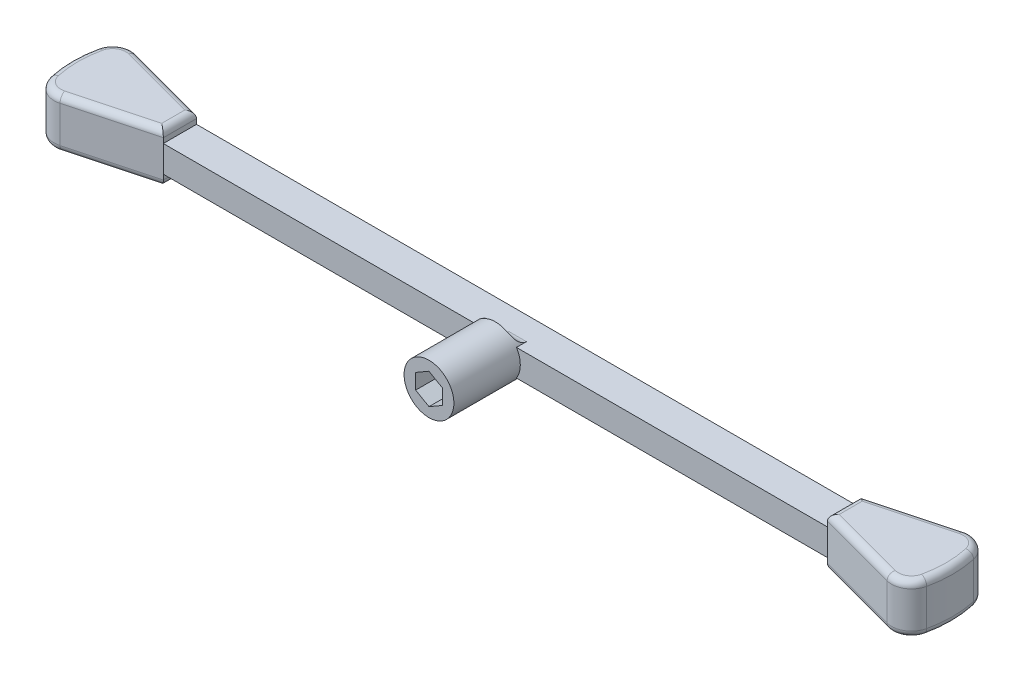
from build123d import *

# Parameters (mm, degrees)
SKETCH_1_R      = 7.5
EXTRUDE_1_DEPTH = 20
SKETCH_2_W      = 200
SKETCH_2_H      = 8
EXTRUDE_2_DEPTH = 10
EXTRUDE_3_DEPTH = 7.5
FILLET_2_R      = 6
FILLET_3_R      = 2
FILLET_4_R      = 3


with BuildPart() as part:
    # 草图1 → 凸台-拉伸1 (new body)
    with BuildSketch(Plane.XY):
        Circle(SKETCH_1_R)
        Polygon((0, -4.618802154), (4, -2.309401077), (4, 2.309401077), (0, 4.618802154), (-4, 2.309401077), (-4, -2.309401077), align=None, mode=Mode.SUBTRACT)
    extrude(amount=EXTRUDE_1_DEPTH)

    # 草图2 → 凸台-拉伸2 (add)
    with BuildSketch(Plane(origin=(0, 0, 0), x_dir=(-1, 0, 0), z_dir=(0, 0, -1))):
        Rectangle(SKETCH_2_W, SKETCH_2_H)
    extrude(amount=EXTRUDE_2_DEPTH)

    # 草图3 → 凸台-拉伸3 (add, symmetric)
    with BuildSketch(Plane(origin=(0, 0, 0), x_dir=(1, 0, 0), z_dir=(0, 1, 0))):
        with BuildLine():
            Line((-100, 10), (-130, 18.038475773))
            ThreePointArc((-130, 18.038475773), (-132.710882753, 5), (-130, -8.038475773))
            Line((-130, -8.038475773), (-100, 0))
            Line((-100, 0), (-100, 10))
        make_face()
        with BuildLine():
            Line((100, 10), (100, 0))
            Line((100, 0), (130, -8.038475773))
            ThreePointArc((130, -8.038475773), (132.710882753, 5), (130, 18.038475773))
            Line((130, 18.038475773), (100, 10))
        make_face()
    extrude(amount=EXTRUDE_3_DEPTH, both=True)

    # 圆角2
    fillet_2_edges = [part.edges().sort_by_distance(p)[0] for p in [
        (-130, 0, -18.038475773),
        (-130, 0, 8.038475773),
        (130, 0, 8.038475773),
        (130, 0, -18.038475773),
    ]]
    fillet(fillet_2_edges, radius=FILLET_2_R)

    # 圆角3
    fillet_3_edges = [part.edges().sort_by_distance(p)[0] for p in [
        (-100, -7.5, -5),
        (-112.262976322, -7.5, -13.285854602),
        (-100, 7.5, -5),
        (-112.262976322, 7.5, -13.285854602),
        (100, -7.5, -5),
        (112.262976322, -7.5, 3.285854602),
        (100, 7.5, -5),
        (112.262976322, 7.5, 3.285854602),
        (-132.710882753, -7.5, -5),
        (-132.710882753, 7.5, -5),
        (-112.262976322, -7.5, 3.285854602),
        (-129.192011847, -7.5, 5.905318763),
        (-129.192011847, -7.5, -15.905318763),
        (-112.262976322, 7.5, 3.285854602),
        (-129.192011847, 7.5, 5.905318763),
        (-129.192011847, 7.5, -15.905318763),
        (112.262976322, -7.5, -13.285854602),
        (112.262976322, 7.5, -13.285854602),
        (132.710882753, -7.5, -5),
        (129.192011847, -7.5, 5.905318763),
        (129.192011847, -7.5, -15.905318763),
        (132.710882753, 7.5, -5),
        (129.192011847, 7.5, 5.905318763),
        (129.192011847, 7.5, -15.905318763),
    ]]
    fillet(fillet_3_edges, radius=FILLET_3_R)

    # 圆角4
    # the kernel refuses this fillet: 3 mm, written as the material it adds along each edge
    with BuildSketch(Plane(origin=(-6.42820323, -4, 0), x_dir=(0, 0, -1), z_dir=(1, 0, 0))) as fillet_4_piece_1_section:
        with BuildLine():
            CenterArc((FILLET_4_R, -FILLET_4_R), FILLET_4_R, 90, 90)
            Line((0, -FILLET_4_R), (0, 0))
            Line((0, 0), (FILLET_4_R, 0))
        make_face()
    fillet_4_piece_1 = extrude(amount=20.272492001, mode=Mode.PRIVATE)
    fillet_4_piece_1 = fillet_4_piece_1 & Plane(origin=(0, 0, -0.715829883), x_dir=(1, 0, 0), z_dir=(0, 0, -1)) * Cylinder(7.5, 53, mode=Mode.PRIVATE)
    fillet_4_piece_1 = split(fillet_4_piece_1, bisect_by=Plane(origin=(-2.485789841, -3.18363072, -0.715829883), z_dir=(-0.5000000000000003, -0.8660254037844387, 0)), keep=Keep.TOP, mode=Mode.PRIVATE)
    add(fillet_4_piece_1)
    with BuildSketch(Plane(origin=(-6.42820323, -4, 0), x_dir=(0, 0, -1), z_dir=(1, 0, 0))) as fillet_4_piece_2_section:
        with BuildLine():
            CenterArc((FILLET_4_R, -FILLET_4_R), FILLET_4_R, 90, 90)
            Line((0, -FILLET_4_R), (0, 0))
            Line((0, 0), (FILLET_4_R, 0))
        make_face()
    fillet_4_piece_2 = extrude(amount=20.272492001, mode=Mode.PRIVATE)
    fillet_4_piece_2 = fillet_4_piece_2 & Plane(origin=(0, 0, -0.715830721), x_dir=(1, 0, 0), z_dir=(0, 0, -1)) * Cylinder(7.5, 53, mode=Mode.PRIVATE)
    fillet_4_piece_2 = split(fillet_4_piece_2, bisect_by=Plane(origin=(2.485790597, -3.183630283, -0.715830721), z_dir=(0.4999999999999999, -0.8660254037844388, 0)), keep=Keep.TOP, mode=Mode.PRIVATE)
    add(fillet_4_piece_2)
    with BuildSketch(Plane(origin=(-13.84428877, -4, 0), x_dir=(0, 0, -1), z_dir=(1, 0, 0))) as fillet_4_piece_3_section:
        with BuildLine():
            CenterArc((FILLET_4_R, -FILLET_4_R), FILLET_4_R, 90, 90)
            Line((0, -FILLET_4_R), (0, 0))
            Line((0, 0), (FILLET_4_R, 0))
        make_face()
    fillet_4_piece_3 = extrude(amount=20.272492001, mode=Mode.PRIVATE)
    fillet_4_piece_3 = fillet_4_piece_3 & Plane(origin=(0, 0, -0.715829883), x_dir=(1, 0, 0), z_dir=(0, 0, -1)) * Cylinder(7.5, 53, mode=Mode.PRIVATE)
    fillet_4_piece_3 = split(fillet_4_piece_3, bisect_by=Plane(origin=(-2.485789841, -3.18363072, -0.715829883), z_dir=(-0.5000000000000003, -0.8660254037844387, 0)), keep=Keep.TOP, mode=Mode.PRIVATE)
    add(fillet_4_piece_3)
    with BuildSketch(Plane(origin=(-13.84428877, -4, 0), x_dir=(0, 0, -1), z_dir=(1, 0, 0))) as fillet_4_piece_4_section:
        with BuildLine():
            CenterArc((FILLET_4_R, -FILLET_4_R), FILLET_4_R, 90, 90)
            Line((0, -FILLET_4_R), (0, 0))
            Line((0, 0), (FILLET_4_R, 0))
        make_face()
    fillet_4_piece_4 = extrude(amount=20.272492001, mode=Mode.PRIVATE)
    fillet_4_piece_4 = fillet_4_piece_4 & Plane(origin=(0, 0, -0.715830721), x_dir=(1, 0, 0), z_dir=(0, 0, -1)) * Cylinder(7.5, 53, mode=Mode.PRIVATE)
    fillet_4_piece_4 = split(fillet_4_piece_4, bisect_by=Plane(origin=(2.485790597, -3.183630283, -0.715830721), z_dir=(0.4999999999999999, -0.8660254037844388, 0)), keep=Keep.TOP, mode=Mode.PRIVATE)
    add(fillet_4_piece_4)
    with BuildSketch(Plane(origin=(6.42820323, 4, 0), x_dir=(0, 0, -1), z_dir=(-1, 0, 0))) as fillet_4_piece_5_section:
        with BuildLine():
            CenterArc((FILLET_4_R, -FILLET_4_R), FILLET_4_R, 90, 90)
            Line((0, -FILLET_4_R), (0, 0))
            Line((0, 0), (FILLET_4_R, 0))
        make_face()
    fillet_4_piece_5 = extrude(amount=20.272492001, mode=Mode.PRIVATE)
    fillet_4_piece_5 = fillet_4_piece_5 & Plane(origin=(0, 0, -0.715829883), x_dir=(1, 0, 0), z_dir=(0, 0, -1)) * Cylinder(7.5, 53, mode=Mode.PRIVATE)
    fillet_4_piece_5 = split(fillet_4_piece_5, bisect_by=Plane(origin=(2.485789841, 3.18363072, -0.715829883), z_dir=(0.5, 0.8660254037844387, 0)), keep=Keep.TOP, mode=Mode.PRIVATE)
    add(fillet_4_piece_5)
    with BuildSketch(Plane(origin=(6.42820323, 4, 0), x_dir=(0, 0, -1), z_dir=(-1, 0, 0))) as fillet_4_piece_6_section:
        with BuildLine():
            CenterArc((FILLET_4_R, -FILLET_4_R), FILLET_4_R, 90, 90)
            Line((0, -FILLET_4_R), (0, 0))
            Line((0, 0), (FILLET_4_R, 0))
        make_face()
    fillet_4_piece_6 = extrude(amount=20.272492001, mode=Mode.PRIVATE)
    fillet_4_piece_6 = fillet_4_piece_6 & Plane(origin=(0, 0, -0.715830721), x_dir=(1, 0, 0), z_dir=(0, 0, -1)) * Cylinder(7.5, 53, mode=Mode.PRIVATE)
    fillet_4_piece_6 = split(fillet_4_piece_6, bisect_by=Plane(origin=(-2.485790597, 3.183630283, -0.715830721), z_dir=(-0.5000000000000001, 0.8660254037844387, 0)), keep=Keep.TOP, mode=Mode.PRIVATE)
    add(fillet_4_piece_6)
    with BuildSketch(Plane(origin=(13.84428877, 4, 0), x_dir=(0, 0, -1), z_dir=(-1, 0, 0))) as fillet_4_piece_7_section:
        with BuildLine():
            CenterArc((FILLET_4_R, -FILLET_4_R), FILLET_4_R, 90, 90)
            Line((0, -FILLET_4_R), (0, 0))
            Line((0, 0), (FILLET_4_R, 0))
        make_face()
    fillet_4_piece_7 = extrude(amount=20.272492001, mode=Mode.PRIVATE)
    fillet_4_piece_7 = fillet_4_piece_7 & Plane(origin=(0, 0, -0.715829883), x_dir=(1, 0, 0), z_dir=(0, 0, -1)) * Cylinder(7.5, 53, mode=Mode.PRIVATE)
    fillet_4_piece_7 = split(fillet_4_piece_7, bisect_by=Plane(origin=(2.485789841, 3.18363072, -0.715829883), z_dir=(0.5, 0.8660254037844387, 0)), keep=Keep.TOP, mode=Mode.PRIVATE)
    add(fillet_4_piece_7)
    with BuildSketch(Plane(origin=(13.84428877, 4, 0), x_dir=(0, 0, -1), z_dir=(-1, 0, 0))) as fillet_4_piece_8_section:
        with BuildLine():
            CenterArc((FILLET_4_R, -FILLET_4_R), FILLET_4_R, 90, 90)
            Line((0, -FILLET_4_R), (0, 0))
            Line((0, 0), (FILLET_4_R, 0))
        make_face()
    fillet_4_piece_8 = extrude(amount=20.272492001, mode=Mode.PRIVATE)
    fillet_4_piece_8 = fillet_4_piece_8 & Plane(origin=(0, 0, -0.715830721), x_dir=(1, 0, 0), z_dir=(0, 0, -1)) * Cylinder(7.5, 53, mode=Mode.PRIVATE)
    fillet_4_piece_8 = split(fillet_4_piece_8, bisect_by=Plane(origin=(-2.485790597, 3.183630283, -0.715830721), z_dir=(-0.5000000000000001, 0.8660254037844387, 0)), keep=Keep.TOP, mode=Mode.PRIVATE)
    add(fillet_4_piece_8)


solid = part.part
